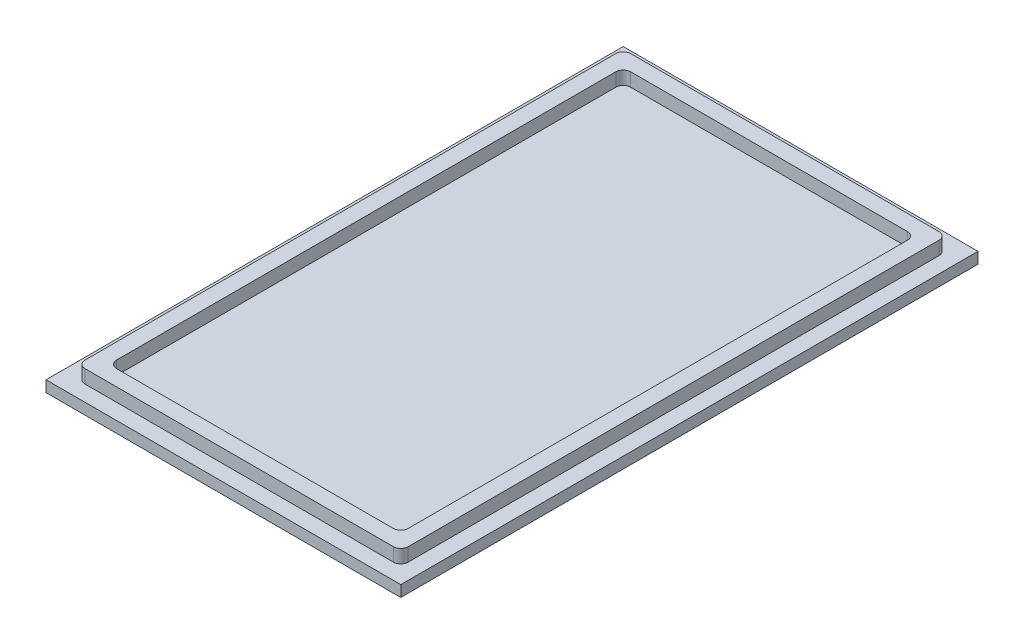
from build123d import *

# Parameters (mm, degrees)
PCB_DIMENSIONS_W    = 47.716732244
PCB_DIMENSIONS_H    = 77.636732244
BOSS_EXTRUDE3_DEPTH = 1.5
SKETCH5_W           = 43.474091557
SKETCH5_H           = 73.394091557
SKETCH5_W_2         = 39.23145087
SKETCH5_H_2         = 69.15145087
BOSS_EXTRUDE4_DEPTH = 1.8
FILLET1_R           = 1
SKETCH6_W           = 24
SKETCH6_H           = 64
BOSS_EXTRUDE5_DEPTH = 10
SKETCH7_W           = 48
SKETCH7_H           = 6
CUT_EXTRUDE1_DEPTH  = 24
FILLET2_R           = 6
FILLET3_R           = 1


with BuildPart() as part:
    # PCB Dimensions → Boss-Extrude3 (new body)
    with BuildSketch(Plane(origin=(0, 0, 0), x_dir=(1, 0, 0), z_dir=(0, 1, 0))):
        with Locations((20.322832216, -35.282832216)):
            Rectangle(PCB_DIMENSIONS_W, PCB_DIMENSIONS_H)
    extrude(amount=BOSS_EXTRUDE3_DEPTH)

    # Sketch5 → Boss-Extrude4 (add)
    with BuildSketch(Plane(origin=(0, 1.5, 0), x_dir=(1, 0, 0), z_dir=(0, 1, 0))):
        with Locations((20.322832217, -35.282832217)):
            Rectangle(SKETCH5_W, SKETCH5_H)
        with Locations((20.322832216, -35.282832216)):
            Rectangle(SKETCH5_W_2, SKETCH5_H_2, mode=Mode.SUBTRACT)
    extrude(amount=BOSS_EXTRUDE4_DEPTH)

    # Fillet1
    fillet1_edges = [part.edges().sort_by_distance(p)[0] for p in [
        (0.707106781, 2.4, 69.858557651),
        (-1.414213562, 2.4, 71.979877995),
        (39.938557651, 2.4, 69.858557651),
        (42.059877995, 2.4, 71.979877995),
        (0.707106781, 2.4, 0.707106781),
        (39.938557651, 2.4, 0.707106781),
        (42.059877995, 2.4, -1.414213562),
        (-1.414213562, 2.4, -1.414213562),
    ]]
    fillet(fillet1_edges, radius=FILLET1_R)

    # Sketch6 → Boss-Extrude5 (add)
    with BuildSketch(Plane.XZ):
        with Locations((20.322832216, 35.249738628)):
            Rectangle(SKETCH6_W, SKETCH6_H)
    extrude(amount=BOSS_EXTRUDE5_DEPTH)

    # Sketch7 → Cut-Extrude1 (cut)
    with BuildSketch(Plane(origin=(32.322832216, 0, 0), x_dir=(0, 0, -1), z_dir=(1, 0, 0))):
        with Locations((-35.249738628, -3)):
            Rectangle(SKETCH7_W, SKETCH7_H)
    extrude(amount=-CUT_EXTRUDE1_DEPTH, mode=Mode.SUBTRACT)

    # Fillet2
    fillet2_edges = [part.edges().sort_by_distance(p)[0] for p in [
        (20.322832216, -10, 3.249738628),
        (20.322832216, -10, 67.249738628),
    ]]
    fillet(fillet2_edges, radius=FILLET2_R)

    # Fillet3
    fillet3_edges = [part.edges().sort_by_distance(p)[0] for p in [
        (20.322832216, -6, 11.249738628),
        (20.322832216, -6, 59.249738628),
    ]]
    fillet(fillet3_edges, radius=FILLET3_R)


solid = part.part
